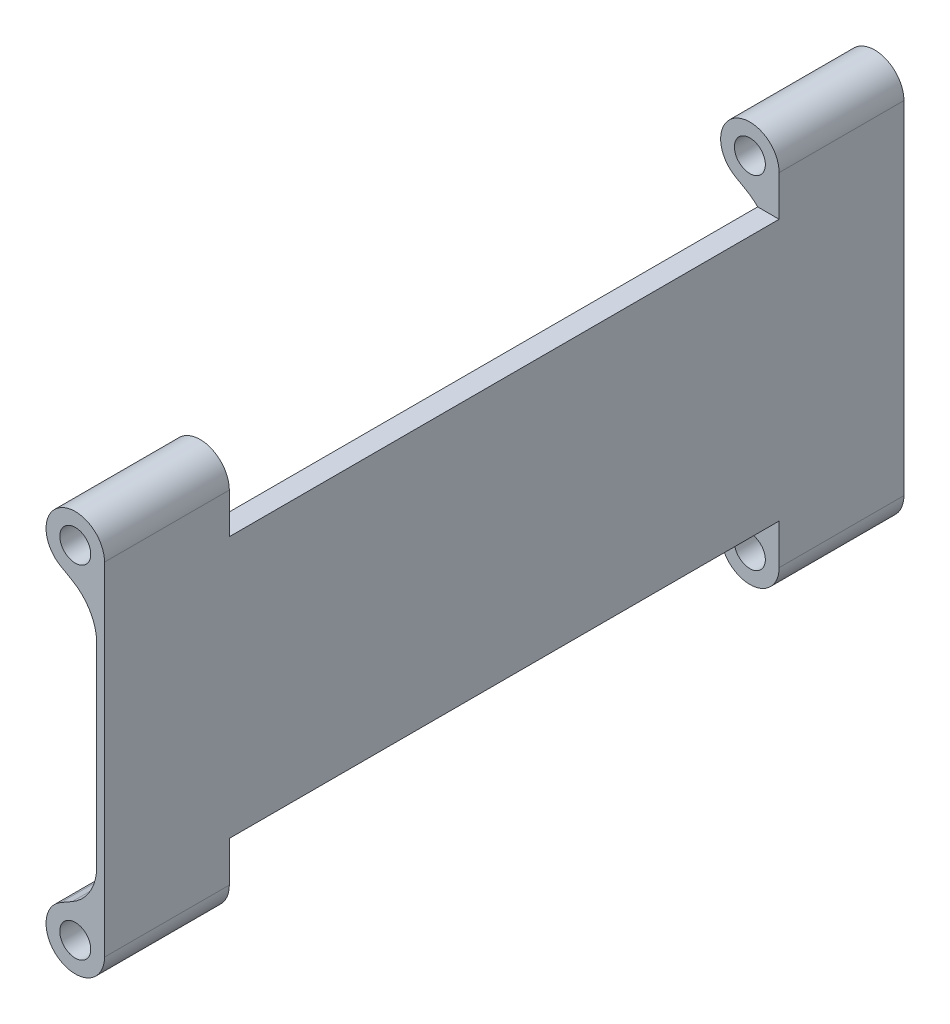
from build123d import *

# Parameters (mm, degrees)
CROQUIS1_R              = 3.175
SALIENTE_EXTRUIR1_DEPTH = 164
REDONDEO1_R             = 10
CROQUIS3_W              = 112.791812306
CROQUIS3_H              = 18.145434914
CORTAR_EXTRUIR2_DEPTH   = 170.494507581


with BuildPart() as part:
    # Croquis1 → Saliente-Extruir1 (new body)
    with BuildSketch(Plane.XY):
        with BuildLine():
            Line((-1.6, 25.646228096), (-8.98691391, 29.886314259))
            ThreePointArc((-8.98691391, 29.886314259), (-9.006535925, 40.28237342), (0, 35.09))
            Line((0, 35.09), (0, -35.09))
            ThreePointArc((0, -35.09), (-9.006535925, -40.28237342), (-8.98691391, -29.886314259))
            Line((-8.98691391, -29.886314259), (-1.6, -25.646228096))
            Line((-1.6, -25.646228096), (-1.6, 25.646228096))
        make_face()
        with Locations((-6, 35.09)):
            Circle(CROQUIS1_R, mode=Mode.SUBTRACT)
        with Locations((-6, -35.09)):
            Circle(CROQUIS1_R, mode=Mode.SUBTRACT)
    extrude(amount=-SALIENTE_EXTRUIR1_DEPTH)

    # Redondeo1
    redondeo1_edges = [part.edges().sort_by_distance(p)[0] for p in [
        (-1.6, -25.646228096, -82),
        (-1.6, 25.646228096, -82),
    ]]
    fillet(redondeo1_edges, radius=REDONDEO1_R)

    # Croquis3 → Cortar-Extruir2 (cut, through all)
    with BuildSketch(Plane(origin=(0, 0, 0), x_dir=(0, 0, -1), z_dir=(1, 0, 0))):
        with Locations((82, 35.875128035)):
            Rectangle(CROQUIS3_W, CROQUIS3_H)
        with Locations((82, -35.875128035)):
            Rectangle(CROQUIS3_W, CROQUIS3_H)
    extrude(amount=-CORTAR_EXTRUIR2_DEPTH, mode=Mode.SUBTRACT)


solid = part.part
